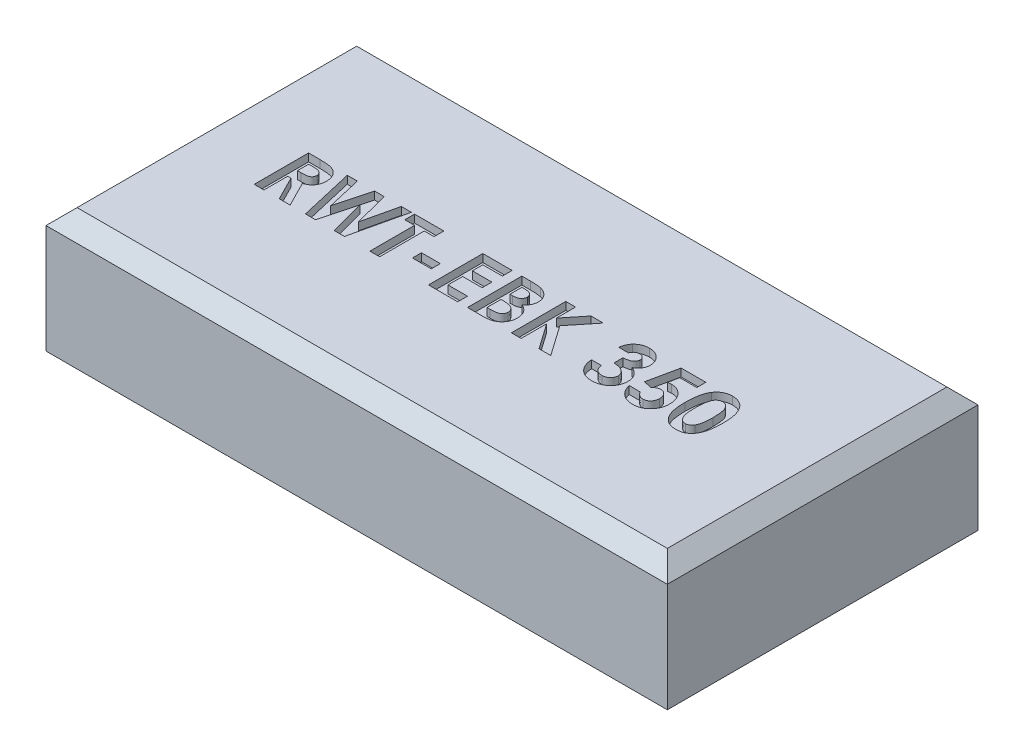
from build123d import *

# Parameters (mm, degrees)
SKETCH1_W           = 40
SKETCH1_H           = 20
BOSS_EXTRUDE1_DEPTH = 8
CHAMFER1_SIZE       = 1
SKETCH4_W           = 1.211538461
SKETCH4_H           = 0.583333333
CUT_EXTRUDE3_DEPTH  = 0.5


with BuildPart() as part:
    # Sketch1 → Boss-Extrude1 (new body)
    with BuildSketch(Plane(origin=(0, 0, 0), x_dir=(1, 0, 0), z_dir=(0, 1, 0))):
        with Locations((0, 2.318501171)):
            Rectangle(SKETCH1_W, SKETCH1_H)
    extrude(amount=BOSS_EXTRUDE1_DEPTH)

    # Chamfer1
    chamfer1_edges = [part.edges().sort_by_distance(p)[0] for p in [
        (0, 8, 7.681498829),
        (-20, 8, -2.318501171),
        (0, 8, -12.318501171),
        (20, 8, -2.318501171),
    ]]
    chamfer(chamfer1_edges, length=CHAMFER1_SIZE)

    # Sketch4 → Cut-Extrude3 (cut)
    # profile 1 of 10: a face of its own
    with BuildSketch(Plane(origin=(0, 8, 0), x_dir=(1, 0, 0), z_dir=(0, 1, 0))):
        with BuildLine():
            Line((-14.596153846, 3.818501171), (-13.864182692, 3.818501171))
            add(Edge.make_bspline(
                [(-13.864182692, 3.818501171), (-13.815799622, 3.818329439), (-13.722745349, 3.81799915), (-13.588566169, 3.81278806), (-13.46530414, 3.805536401), (-13.352776761, 3.794470177), (-13.251032173, 3.779797701), (-13.159968404, 3.76250128), (-13.079588115, 3.742788301), (-13.009213411, 3.718224373), (-12.945703721, 3.690516634), (-12.886503859, 3.658679935), (-12.830307791, 3.623068786), (-12.777491125, 3.582746162), (-12.727594872, 3.538437457), (-12.6805249, 3.49009807), (-12.636946351, 3.437318103), (-12.597129066, 3.380431058), (-12.560838815, 3.320587191), (-12.528765845, 3.257704336), (-12.502684052, 3.191738763), (-12.479637993, 3.123643816), (-12.463038663, 3.052446065), (-12.451494071, 2.978838632), (-12.443041573, 2.902562411), (-12.442555595, 2.850743733), (-12.442307692, 2.824310466)],
                knots=[0, 0, 0, 0, 1.749336639, 3.364467119, 4.854658419, 6.213483162, 7.451590619, 8.570285859, 9.5643256, 10.440900261, 11.26203566, 12.067320669, 12.869050712, 13.665104639, 14.467235401, 15.27997916, 16.102287765, 16.939272006, 17.78853747, 18.631303466, 19.488103222, 20.351255419, 21.228522269, 22.127379805, 23.044756219, 24, 24, 24, 24], degree=3))
            add(Edge.make_bspline(
                [(-12.442307692, 2.824310466), (-12.442951654, 2.796720207), (-12.444214347, 2.742620739), (-12.451015895, 2.663153032), (-12.46344699, 2.587123888), (-12.48227569, 2.514755912), (-12.503916836, 2.4451484), (-12.532694008, 2.379585653), (-12.565171892, 2.317114157), (-12.603744925, 2.258617595), (-12.646076944, 2.20279664), (-12.695308193, 2.151790002), (-12.748249241, 2.102856265), (-12.807876098, 2.059060474), (-12.871560358, 2.017441316), (-12.940567358, 1.979723274), (-13.014446736, 1.944958206), (-13.066387598, 1.925570802), (-13.092948718, 1.91565662)],
                knots=[0, 0, 0, 0, 1.099860209, 2.156625411, 3.176576793, 4.16617041, 5.135385252, 6.078461593, 7.016046972, 7.938469504, 8.868247731, 9.803980173, 10.76021508, 11.73834243, 12.748633912, 13.790971185, 14.870363756, 16, 16, 16, 16], degree=3))
            Line((-13.092948718, 1.91565662), (-12.28525641, 0.318501171))
            Line((-12.28525641, 0.318501171), (-12.983573718, 0.318501171))
            Line((-12.983573718, 0.318501171), (-13.754807692, 1.844142197))
            Line((-13.754807692, 1.844142197), (-13.967948718, 1.844142197))
            Line((-13.967948718, 1.844142197), (-13.967948718, 0.318501171))
            Line((-13.967948718, 0.318501171), (-14.596153846, 0.318501171))
            Line((-14.596153846, 0.318501171), (-14.596153846, 3.818501171))
        make_face()
        with BuildLine():
            Line((-13.967948718, 2.472347325), (-13.723257212, 2.472347325))
            add(Edge.make_bspline(
                [(-13.723257212, 2.472347325), (-13.693341641, 2.472684254), (-13.636059751, 2.473329401), (-13.55368087, 2.476321861), (-13.4788612, 2.483532211), (-13.41127944, 2.492642218), (-13.350595524, 2.503161037), (-13.297350732, 2.518235143), (-13.250724642, 2.534387429), (-13.211269776, 2.554460531), (-13.177560445, 2.577288002), (-13.148454596, 2.603220576), (-13.124379885, 2.633234229), (-13.104565169, 2.666513318), (-13.089151475, 2.70335219), (-13.07790066, 2.743346436), (-13.071613117, 2.786951643), (-13.070889714, 2.817045173), (-13.070512821, 2.832723927)],
                knots=[0, 0, 0, 0, 1.688639943, 3.233382647, 4.650958383, 5.928841754, 7.082724185, 8.122798841, 9.049171256, 9.863274652, 10.613301712, 11.341792392, 12.054588806, 12.776240173, 13.521029143, 14.301969904, 15.115324896, 16, 16, 16, 16], degree=3))
            add(Edge.make_bspline(
                [(-13.070512821, 2.832723927), (-13.071225372, 2.851273039), (-13.072625049, 2.88770933), (-13.086514186, 2.940164814), (-13.108622693, 2.988715953), (-13.1389274, 3.033143381), (-13.177092239, 3.072091531), (-13.220889403, 3.106424636), (-13.27126414, 3.133572687), (-13.317907356, 3.151479252), (-13.36034178, 3.162192934), (-13.398637509, 3.170176676), (-13.442984193, 3.175834983), (-13.493415313, 3.181836624), (-13.549802317, 3.185728385), (-13.612452548, 3.188568594), (-13.681186076, 3.189730664), (-13.729099873, 3.190102157), (-13.754106571, 3.190296043)],
                knots=[0, 0, 0, 0, 1.020303359, 2.004196876, 2.966617323, 3.9489082, 4.950758222, 5.960522915, 7.003732012, 8.091992268, 8.70421221, 9.413913587, 10.24622431, 11.166358409, 12.212345909, 13.359657661, 14.621978493, 16, 16, 16, 16], degree=3))
            Line((-13.754106571, 3.190296043), (-13.967948718, 3.190296043))
            Line((-13.967948718, 3.190296043), (-13.967948718, 2.472347325))
        make_face(mode=Mode.SUBTRACT)
    # profile 2 of 10: a face of its own
    with BuildSketch(Plane(origin=(0, 8, 0), x_dir=(1, 0, 0), z_dir=(0, 1, 0))):
        Polygon((-12.105769231, 3.818501171), (-11.457231571, 3.818501171), (-10.939102564, 1.584026011), (-10.345252404, 3.818501171), (-9.734575321, 3.818501171), (-9.144230769, 1.584026011), (-8.627504006, 3.818501171), (-7.977564103, 3.818501171), (-8.787359776, 0.318501171), (-9.443609776, 0.318501171), (-10.041666667, 2.581021203), (-10.643229167, 0.318501171), (-11.294571314, 0.318501171), align=None)
    # profile 3 of 10: a face of its own
    with BuildSketch(Plane(origin=(0, 8, 0), x_dir=(1, 0, 0), z_dir=(0, 1, 0))):
        Polygon((-7.775641026, 3.818501171), (-5.891025641, 3.818501171), (-5.891025641, 3.190296043), (-6.519230769, 3.190296043), (-6.519230769, 0.318501171), (-7.147435897, 0.318501171), (-7.147435897, 3.190296043), (-7.775641026, 3.190296043), align=None)
    # profile 4 of 10: a face of its own
    with BuildSketch(Plane(origin=(0, 8, 0), x_dir=(1, 0, 0), z_dir=(0, 1, 0))):
        with Locations((-4.791666667, 1.597347325)):
            Rectangle(SKETCH4_W, SKETCH4_H)
    # profile 5 of 10: a face of its own
    with BuildSketch(Plane(origin=(0, 8, 0), x_dir=(1, 0, 0), z_dir=(0, 1, 0))):
        Polygon((-3.378205128, 3.818501171), (-1.493589744, 3.818501171), (-1.493589744, 3.190296043), (-2.75, 3.190296043), (-2.75, 2.51721912), (-1.493589744, 2.51721912), (-1.493589744, 1.889013991), (-2.75, 1.889013991), (-2.75, 0.946706299), (-1.493589744, 0.946706299), (-1.493589744, 0.318501171), (-3.378205128, 0.318501171), align=None)
    # profile 6 of 10: a face of its own
    with BuildSketch(Plane(origin=(0, 8, 0), x_dir=(1, 0, 0), z_dir=(0, 1, 0))):
        with BuildLine():
            Line((-0.865384615, 0.318501171), (-0.865384615, 3.818501171))
            Line((-0.865384615, 3.818501171), (-0.304487179, 3.818501171))
            add(Edge.make_bspline(
                [(-0.304487179, 3.818501171), (-0.265220852, 3.818505652), (-0.189241252, 3.818514323), (-0.079622519, 3.814664873), (0.022039599, 3.809685178), (0.115421572, 3.804114058), (0.200682344, 3.794513904), (0.277692262, 3.784396391), (0.346605192, 3.772195293), (0.389210312, 3.76125053), (0.409254808, 3.756101331)],
                knots=[0, 0, 0, 0, 1.311965854, 2.538629056, 3.664479157, 4.713267157, 5.663616078, 6.530575999, 7.308677837, 8, 8, 8, 8], degree=3))
            add(Edge.make_bspline(
                [(0.409254808, 3.756101331), (0.435575266, 3.748838294), (0.487224455, 3.734585883), (0.561202576, 3.705802524), (0.631381143, 3.673807779), (0.697674471, 3.637307759), (0.759675491, 3.595861807), (0.817148578, 3.549140995), (0.871333285, 3.499020694), (0.920305637, 3.444104065), (0.964568575, 3.386074475), (1.003025131, 3.324947127), (1.03643895, 3.2616567), (1.063178757, 3.195406725), (1.083326699, 3.126502301), (1.09806282, 3.055237661), (1.107613822, 2.981387306), (1.108516267, 2.931144495), (1.108974359, 2.905640594)],
                knots=[0, 0, 0, 0, 1.099996261, 2.158545794, 3.195537121, 4.207578794, 5.205712374, 6.197378256, 7.190519799, 8.17788031, 9.159561366, 10.129234751, 11.085776129, 12.040971148, 13.00380137, 13.975669004, 14.972423361, 16, 16, 16, 16], degree=3))
            add(Edge.make_bspline(
                [(1.108974359, 2.905640594), (1.107776583, 2.872874775), (1.105418909, 2.808379286), (1.090357925, 2.713647082), (1.062116233, 2.624111532), (1.025162666, 2.538122532), (0.974917368, 2.456000819), (0.911115557, 2.377785442), (0.834790614, 2.30106803), (0.776245169, 2.255081117), (0.745793269, 2.231161427)],
                knots=[0, 0, 0, 0, 0.986156485, 1.941127874, 2.875419072, 3.804401753, 4.751181392, 5.761612777, 6.835722519, 8, 8, 8, 8], degree=3))
            add(Edge.make_bspline(
                [(0.745793269, 2.231161427), (0.770470028, 2.218564156), (0.818854324, 2.193864392), (0.887545811, 2.153265354), (0.951146629, 2.110083128), (1.009941945, 2.065186558), (1.062698461, 2.016672412), (1.111594582, 1.967336144), (1.154218027, 1.914350989), (1.192333195, 1.85960544), (1.225462281, 1.802306775), (1.254314061, 1.742551757), (1.278684124, 1.680136252), (1.299321324, 1.615377904), (1.314712554, 1.548053973), (1.324747963, 1.478140383), (1.332431699, 1.405875574), (1.333029422, 1.35665059), (1.333333333, 1.331622165)],
                knots=[0, 0, 0, 0, 1.164658916, 2.283573913, 3.35186032, 4.395461096, 5.390182219, 6.362969632, 7.312859996, 8.245001507, 9.165155236, 10.092416118, 11.032087915, 11.979892451, 12.947605196, 13.931445124, 14.948243989, 16, 16, 16, 16], degree=3))
            add(Edge.make_bspline(
                [(1.333333333, 1.331622165), (1.331361149, 1.283819302), (1.327469051, 1.189480545), (1.29901193, 1.050969584), (1.249676325, 0.91964863), (1.18342878, 0.796039608), (1.101799059, 0.683720797), (1.007948289, 0.585330494), (0.902821331, 0.502045287), (0.805829006, 0.445834233), (0.721938284, 0.40811136), (0.652453165, 0.384788701), (0.577827621, 0.363182624), (0.49669469, 0.348010391), (0.410525202, 0.334123096), (0.318478999, 0.325548791), (0.220728113, 0.319738197), (0.153588579, 0.318921849), (0.118990385, 0.318501171)],
                knots=[0, 0, 0, 0, 1.284142165, 2.534249414, 3.780121997, 5.041676246, 6.291546858, 7.49970053, 8.684500223, 9.883330709, 10.50184324, 11.153274765, 11.851151195, 12.587658647, 13.369265475, 14.195992086, 15.070362669, 16, 16, 16, 16], degree=3))
            Line((0.118990385, 0.318501171), (-0.865384615, 0.318501171))
        make_face()
        with BuildLine():
            Line((-0.237179487, 3.190296043), (-0.237179487, 2.42747553))
            Line((-0.237179487, 2.42747553), (-0.0703125, 2.42747553))
            add(Edge.make_bspline(
                [(-0.0703125, 2.42747553), (-0.047633777, 2.427673297), (-0.003853875, 2.428055074), (0.059381549, 2.432972233), (0.118180282, 2.441361212), (0.172319311, 2.453065948), (0.222302963, 2.467929257), (0.267811927, 2.485813017), (0.308646108, 2.507633149), (0.356085982, 2.540135198), (0.406233349, 2.587963419), (0.450377513, 2.657061193), (0.476378131, 2.736523371), (0.479273899, 2.792566252), (0.480769231, 2.821505979)],
                knots=[0, 0, 0, 0, 1.065314748, 2.056525647, 2.977365736, 3.853934255, 4.656397591, 5.425096493, 6.14721249, 6.826394842, 8.123232004, 9.372140726, 10.643011755, 12, 12, 12, 12], degree=3))
            add(Edge.make_bspline(
                [(0.480769231, 2.821505979), (0.479572691, 2.848612841), (0.47725923, 2.901022871), (0.451079951, 2.97461122), (0.410418355, 3.039825558), (0.362411626, 3.084459439), (0.317203962, 3.114943064), (0.278494386, 3.135015233), (0.236007719, 3.152983634), (0.188921466, 3.166722711), (0.137504514, 3.17703203), (0.082006625, 3.184602991), (0.022332045, 3.189756109), (-0.018885315, 3.190112204), (-0.040164263, 3.190296043)],
                knots=[0, 0, 0, 0, 1.347982417, 2.606269829, 3.849316587, 5.153353503, 5.842674298, 6.568177932, 7.326619318, 8.142485038, 9.012069166, 9.942760135, 10.937925643, 12, 12, 12, 12], degree=3))
            Line((-0.040164263, 3.190296043), (-0.237179487, 3.190296043))
        make_face(mode=Mode.SUBTRACT)
        with BuildLine():
            Line((-0.237179487, 1.844142197), (-0.237179487, 0.946706299))
            Line((-0.237179487, 0.946706299), (-0.056290064, 0.946706299))
            add(Edge.make_bspline(
                [(-0.056290064, 0.946706299), (-0.020527995, 0.946910607), (0.048229046, 0.947303413), (0.146723385, 0.952049449), (0.236279363, 0.960603342), (0.316659689, 0.971282188), (0.387987483, 0.985750355), (0.450021639, 1.004144774), (0.503612874, 1.02438184), (0.548439854, 1.049377018), (0.585060929, 1.078465208), (0.618107609, 1.108194036), (0.645051813, 1.142489048), (0.666370569, 1.179878054), (0.684821916, 1.219432285), (0.695950465, 1.262696318), (0.704423352, 1.308387911), (0.704889637, 1.339991798), (0.705128205, 1.356161427)],
                knots=[0, 0, 0, 0, 1.753078804, 3.370512758, 4.83203934, 6.162291463, 7.344201807, 8.395507345, 9.331626367, 10.147333109, 10.898971645, 11.62040215, 12.321813352, 13.025280112, 13.727906689, 14.453419512, 15.208716525, 16, 16, 16, 16], degree=3))
            add(Edge.make_bspline(
                [(0.705128205, 1.356161427), (0.704602095, 1.374651653), (0.703577374, 1.410665639), (0.695208464, 1.463303922), (0.67999942, 1.512445252), (0.660842888, 1.559346239), (0.634185556, 1.602327663), (0.602504228, 1.642876951), (0.564225095, 1.679620976), (0.521177978, 1.714782156), (0.470967777, 1.745567673), (0.413570936, 1.772279563), (0.348675643, 1.79458835), (0.27608088, 1.81235062), (0.196104895, 1.827425213), (0.108163951, 1.83642641), (0.012990452, 1.843120995), (-0.053004401, 1.843794061), (-0.087139423, 1.844142197)],
                knots=[0, 0, 0, 0, 0.845221588, 1.646264278, 2.427170338, 3.19324141, 3.95557735, 4.731569926, 5.540061037, 6.376114724, 7.268642756, 8.224665384, 9.265483498, 10.400594375, 11.639216012, 12.983232105, 14.439614077, 16, 16, 16, 16], degree=3))
            Line((-0.087139423, 1.844142197), (-0.237179487, 1.844142197))
        make_face(mode=Mode.SUBTRACT)
    # profile 7 of 10: a face of its own
    with BuildSketch(Plane(origin=(0, 8, 0), x_dir=(1, 0, 0), z_dir=(0, 1, 0))):
        Polygon((1.961538462, 3.818501171), (2.58974359, 3.818501171), (2.58974359, 2.586630177), (3.582532051, 3.818501171), (4.375500801, 3.818501171), (3.128205128, 2.270424248), (4.496794872, 0.318501171), (3.740284455, 0.318501171), (2.58974359, 1.959827293), (2.58974359, 0.318501171), (1.961538462, 0.318501171), align=None)
    # profile 8 of 10: a face of its own
    with BuildSketch(Plane(origin=(0, 8, 0), x_dir=(1, 0, 0), z_dir=(0, 1, 0))):
        with BuildLine():
            Line((6.852564103, 2.965937068), (6.224358974, 2.965937068))
            add(Edge.make_bspline(
                [(6.224358974, 2.965937068), (6.228794341, 2.997338802), (6.237489585, 3.05889982), (6.25829614, 3.148024838), (6.283183024, 3.232566017), (6.314253028, 3.312255633), (6.350693088, 3.387235639), (6.392132649, 3.45776333), (6.439019689, 3.523535987), (6.474959102, 3.563157697), (6.492888622, 3.582924248)],
                knots=[0, 0, 0, 0, 1.111473889, 2.178970933, 3.205615836, 4.199322666, 5.174200091, 6.12565194, 7.064921805, 8, 8, 8, 8], degree=3))
            add(Edge.make_bspline(
                [(6.492888622, 3.582924248), (6.518749579, 3.60900478), (6.569718807, 3.660406768), (6.654894365, 3.726247036), (6.74417408, 3.783227311), (6.839348495, 3.828401685), (6.938936626, 3.864965107), (7.04373043, 3.88952484), (7.153301684, 3.90582044), (7.22807028, 3.907425614), (7.266225962, 3.908244761)],
                knots=[0, 0, 0, 0, 1.01925491, 2.00884431, 2.983262333, 3.955970413, 4.92937149, 5.924503185, 6.940838805, 8, 8, 8, 8], degree=3))
            add(Edge.make_bspline(
                [(7.266225962, 3.908244761), (7.300148326, 3.90744392), (7.366832858, 3.905869629), (7.464842342, 3.893232074), (7.558286183, 3.87106721), (7.648152109, 3.842087147), (7.733118486, 3.802654929), (7.815060603, 3.756882516), (7.891688996, 3.70074075), (7.963182961, 3.637306204), (8.028863803, 3.568695533), (8.085743699, 3.495356368), (8.134644367, 3.419247767), (8.17493205, 3.339737412), (8.205907803, 3.256690761), (8.227405894, 3.170587565), (8.241476916, 3.081617815), (8.242878758, 3.021146275), (8.243589744, 2.990476331)],
                knots=[0, 0, 0, 0, 1.091422571, 2.145516843, 3.172569842, 4.178562979, 5.178154469, 6.181868002, 7.194278174, 8.227918432, 9.254613415, 10.245994977, 11.209837596, 12.161663635, 13.10878368, 14.055455738, 15.013766427, 16, 16, 16, 16], degree=3))
            add(Edge.make_bspline(
                [(8.243589744, 2.990476331), (8.242130758, 2.95249416), (8.239258465, 2.877718942), (8.21568922, 2.768279854), (8.178796942, 2.663636557), (8.125502458, 2.565253166), (8.058870779, 2.473397426), (7.97711594, 2.39114035), (7.882566532, 2.31719226), (7.811587032, 2.277452547), (7.775240385, 2.257102934)],
                knots=[0, 0, 0, 0, 0.992805628, 1.954529043, 2.915727527, 3.886831945, 4.871318353, 5.87440735, 6.911542536, 8, 8, 8, 8], degree=3))
            add(Edge.make_bspline(
                [(7.775240385, 2.257102934), (7.800188166, 2.248912052), (7.849209437, 2.232817336), (7.91888728, 2.201118976), (7.985142946, 2.166477923), (8.046835538, 2.126234151), (8.104578662, 2.082014939), (8.158020309, 2.033442287), (8.207479781, 1.980622105), (8.252149673, 1.923263901), (8.291795947, 1.86228501), (8.327368437, 1.799094007), (8.35664658, 1.732732589), (8.381448812, 1.663958648), (8.400331819, 1.592154081), (8.413627144, 1.517597124), (8.421312167, 1.440457846), (8.422484265, 1.388196032), (8.423076923, 1.361770402)],
                knots=[0, 0, 0, 0, 1.059543567, 2.081955587, 3.086750234, 4.076226789, 5.052108497, 6.020845489, 6.989030705, 7.970690546, 8.952259656, 9.923888338, 10.895517021, 11.877585046, 12.873342345, 13.889638361, 14.932918083, 16, 16, 16, 16], degree=3))
            add(Edge.make_bspline(
                [(8.423076923, 1.361770402), (8.421875525, 1.322935454), (8.419506612, 1.246360847), (8.404446172, 1.133574287), (8.376406347, 1.026042323), (8.339518404, 0.922527637), (8.290313891, 0.824366565), (8.232408452, 0.729306447), (8.161231032, 0.640643939), (8.082129552, 0.556035035), (7.994282747, 0.479112409), (7.899042519, 0.412423953), (7.798503119, 0.355193392), (7.692028462, 0.308731993), (7.579655542, 0.272951401), (7.461634826, 0.24708754), (7.337470424, 0.231263602), (7.252718505, 0.229604763), (7.209435096, 0.228757581)],
                knots=[0, 0, 0, 0, 1.005138573, 1.981928558, 2.936866704, 3.876260664, 4.820238198, 5.773547, 6.751179199, 7.756627054, 8.768222608, 9.766606018, 10.760583154, 11.757261445, 12.767156078, 13.807575856, 14.880313354, 16, 16, 16, 16], degree=3))
            add(Edge.make_bspline(
                [(7.209435096, 0.228757581), (7.168489689, 0.229650791), (7.088426364, 0.231397344), (6.971316994, 0.246514645), (6.860015623, 0.270900079), (6.754238208, 0.305273369), (6.654393993, 0.349849653), (6.559577553, 0.402930005), (6.471680928, 0.467575977), (6.389724778, 0.540869328), (6.315527135, 0.623100305), (6.249211916, 0.71236407), (6.192241383, 0.809000055), (6.144381897, 0.912595393), (6.106007614, 1.023331819), (6.075738092, 1.140984147), (6.054594335, 1.265782231), (6.048154959, 1.351645968), (6.044871795, 1.395424248)],
                knots=[0, 0, 0, 0, 1.066544725, 2.085487077, 3.070979577, 4.031932826, 4.977951092, 5.916076795, 6.857635327, 7.814973522, 8.776389752, 9.738577119, 10.707772778, 11.69409279, 12.707140348, 13.757286496, 14.856535458, 16, 16, 16, 16], degree=3))
            Line((6.044871795, 1.395424248), (6.673076923, 1.395424248))
            add(Edge.make_bspline(
                [(6.673076923, 1.395424248), (6.677057793, 1.373411954), (6.684811583, 1.33053724), (6.699934873, 1.268464184), (6.719642629, 1.21116692), (6.742429699, 1.158136191), (6.767043166, 1.108675722), (6.796782119, 1.064612209), (6.829467445, 1.024749149), (6.876632609, 0.977359505), (6.944058459, 0.928668623), (7.035105694, 0.88635393), (7.136387121, 0.861552321), (7.20719294, 0.858526601), (7.243790064, 0.856962709)],
                knots=[0, 0, 0, 0, 0.928156231, 1.807827665, 2.648129825, 3.438902246, 4.202261636, 4.936546065, 5.639352463, 6.338805438, 7.70633318, 9.064371875, 10.482673459, 12, 12, 12, 12], degree=3))
            add(Edge.make_bspline(
                [(7.243790064, 0.856962709), (7.263209792, 0.857295725), (7.301248694, 0.857948029), (7.357122177, 0.865177946), (7.410349537, 0.877085623), (7.461029913, 0.893267716), (7.509485937, 0.913552981), (7.554791811, 0.939709615), (7.597870981, 0.970120438), (7.638255136, 1.004310275), (7.675570928, 1.041564958), (7.706619862, 1.082818191), (7.73499634, 1.124738849), (7.755983788, 1.170069529), (7.774373314, 1.216370956), (7.785628643, 1.265323727), (7.794127225, 1.315900945), (7.794621129, 1.350513772), (7.794871795, 1.368080498)],
                knots=[0, 0, 0, 0, 1.110435564, 2.175094844, 3.216326037, 4.226890168, 5.215276772, 6.21526065, 7.213097102, 8.228249917, 9.239874822, 10.221364777, 11.178138315, 12.128914389, 13.072518965, 14.022636769, 14.996447288, 16, 16, 16, 16], degree=3))
            add(Edge.make_bspline(
                [(7.794871795, 1.368080498), (7.794206323, 1.387292705), (7.792881521, 1.425539807), (7.782057749, 1.481353411), (7.764964726, 1.535041599), (7.74122043, 1.586366615), (7.709512568, 1.635139286), (7.672097644, 1.682338139), (7.626027982, 1.725506557), (7.575483393, 1.76817723), (7.516871526, 1.805373188), (7.453046861, 1.839699592), (7.382331987, 1.867012812), (7.306453118, 1.891408576), (7.223974933, 1.909226863), (7.135409592, 1.922164677), (7.040899963, 1.931794874), (6.975753248, 1.933176484), (6.942307692, 1.933885786)],
                knots=[0, 0, 0, 0, 0.809814727, 1.612155564, 2.388397, 3.182215007, 3.988903953, 4.837162975, 5.715530372, 6.646997145, 7.623086902, 8.637258368, 9.698941581, 10.815059213, 11.996518529, 13.252603015, 14.589518788, 16, 16, 16, 16], degree=3))
            Line((6.942307692, 1.933885786), (6.942307692, 2.51721912))
            add(Edge.make_bspline(
                [(6.942307692, 2.51721912), (6.983949398, 2.520765461), (7.061852782, 2.527399962), (7.169986857, 2.542914974), (7.261021809, 2.563653343), (7.337145665, 2.588673062), (7.400354037, 2.6208049), (7.455572522, 2.656277029), (7.503129293, 2.697472724), (7.543321144, 2.743163534), (7.575473375, 2.792231179), (7.59822885, 2.843913002), (7.613255377, 2.896609906), (7.61467914, 2.932652999), (7.615384615, 2.950512389)],
                knots=[0, 0, 0, 0, 1.70044513, 3.18119609, 4.440695891, 5.496282586, 6.431922213, 7.318171381, 8.16090191, 8.983045123, 9.787564368, 10.536848927, 11.275007137, 12, 12, 12, 12], degree=3))
            add(Edge.make_bspline(
                [(7.615384615, 2.950512389), (7.614167468, 2.973299031), (7.611791854, 3.017773733), (7.593341546, 3.0814264), (7.561313904, 3.138167477), (7.518370458, 3.187877565), (7.466042377, 3.229399156), (7.404704693, 3.259543123), (7.335688437, 3.277254049), (7.287131782, 3.279090076), (7.262019231, 3.280039632)],
                knots=[0, 0, 0, 0, 1.009664648, 1.970651636, 2.907870547, 3.878035693, 4.867062054, 5.849714035, 6.887914197, 8, 8, 8, 8], degree=3))
            add(Edge.make_bspline(
                [(7.262019231, 3.280039632), (7.239257527, 3.278919255), (7.194091334, 3.276696084), (7.128044841, 3.26010292), (7.065322678, 3.232170393), (7.007223642, 3.193653085), (6.954586406, 3.147395431), (6.911386421, 3.092612841), (6.875454723, 3.032587436), (6.860224222, 2.988240953), (6.852564103, 2.965937068)],
                knots=[0, 0, 0, 0, 0.98818071, 1.960853194, 2.938124878, 3.957524365, 4.978590984, 5.968022688, 6.978025184, 8, 8, 8, 8], degree=3))
        make_face()
    # profile 9 of 10: a face of its own
    with BuildSketch(Plane(origin=(0, 8, 0), x_dir=(1, 0, 0), z_dir=(0, 1, 0))):
        with BuildLine():
            Line((9.387119391, 3.818501171), (10.980769231, 3.818501171))
            Line((10.980769231, 3.818501171), (10.980769231, 3.235167838))
            Line((10.980769231, 3.235167838), (9.884915865, 3.235167838))
            Line((9.884915865, 3.235167838), (9.748197115, 2.573308863))
            add(Edge.make_bspline(
                [(9.748197115, 2.573308863), (9.766827002, 2.578497522), (9.803568967, 2.588730623), (9.858920782, 2.598993128), (9.912564404, 2.605644958), (9.947765022, 2.606532224), (9.96484375, 2.606962709)],
                knots=[0, 0, 0, 0, 1.05461699, 2.079921384, 3.068411212, 4, 4, 4, 4], degree=3))
            add(Edge.make_bspline(
                [(9.96484375, 2.606962709), (10.002060088, 2.606109919), (10.075421688, 2.60442888), (10.1827404, 2.588470341), (10.285504407, 2.563336125), (10.383399238, 2.527489548), (10.476329265, 2.480834303), (10.564407137, 2.424394534), (10.647740954, 2.358071113), (10.724850358, 2.281822516), (10.795701698, 2.19809983), (10.857302898, 2.107544887), (10.909914167, 2.011448911), (10.951759351, 1.909214572), (10.984787138, 1.801483971), (11.008653754, 1.688188071), (11.022767277, 1.569192598), (11.024670399, 1.488010495), (11.025641026, 1.446606139)],
                knots=[0, 0, 0, 0, 1.01440847, 1.999622559, 2.951875003, 3.895578053, 4.836219714, 5.782137149, 6.743708247, 7.735272588, 8.734977101, 9.730283169, 10.717124674, 11.717316708, 12.737475749, 13.78628267, 14.87096371, 16, 16, 16, 16], degree=3))
            add(Edge.make_bspline(
                [(11.025641026, 1.446606139), (11.024454904, 1.404731748), (11.022114339, 1.322101333), (11.006844297, 1.200605395), (10.979892399, 1.084239715), (10.94287127, 0.972692784), (10.894098303, 0.866784445), (10.835442135, 0.765417568), (10.765911048, 0.669344566), (10.68618738, 0.579550304), (10.599517296, 0.497476624), (10.507234115, 0.425276252), (10.409986156, 0.364520223), (10.30777107, 0.31541908), (10.2011753, 0.276571129), (10.090166491, 0.248291676), (9.974205155, 0.232074981), (9.895482475, 0.229875532), (9.85546875, 0.228757581)],
                knots=[0, 0, 0, 0, 1.06808661, 2.107647099, 3.116961351, 4.110378221, 5.100014249, 6.085620622, 7.093190682, 8.119403071, 9.144090782, 10.133780668, 11.103064255, 12.062861538, 13.020824475, 13.992378307, 14.979551724, 16, 16, 16, 16], degree=3))
            add(Edge.make_bspline(
                [(9.85546875, 0.228757581), (9.819685666, 0.229672135), (9.749113937, 0.231475826), (9.645164879, 0.242562264), (9.544946443, 0.262163189), (9.44899068, 0.290530803), (9.356287975, 0.32544486), (9.267909998, 0.369111487), (9.183371097, 0.420699211), (9.102911331, 0.479266557), (9.027838055, 0.545240399), (8.959319124, 0.617460138), (8.896939715, 0.695015476), (8.84203465, 0.778863212), (8.79477604, 0.868879466), (8.75286614, 0.964003375), (8.718562467, 1.065228337), (8.701154341, 1.135403104), (8.692307692, 1.171065274)],
                knots=[0, 0, 0, 0, 1.054957082, 2.080596141, 3.077793124, 4.061112343, 5.027190972, 5.994718051, 6.962465889, 7.943658696, 8.924948258, 9.904494768, 10.875059, 11.855380583, 12.854004648, 13.869083016, 14.917087635, 16, 16, 16, 16], degree=3))
            Line((8.692307692, 1.171065274), (9.41025641, 1.171065274))
            add(Edge.make_bspline(
                [(9.41025641, 1.171065274), (9.42338053, 1.146352842), (9.448885759, 1.098327052), (9.497402344, 1.034565599), (9.551713581, 0.980192572), (9.611329552, 0.934676733), (9.676636533, 0.900577041), (9.744973386, 0.874717413), (9.8171986, 0.859774091), (9.86638716, 0.857906028), (9.891225962, 0.856962709)],
                knots=[0, 0, 0, 0, 1.104910296, 2.147267069, 3.153527244, 4.136738762, 5.099945312, 6.05603338, 7.018353, 8, 8, 8, 8], degree=3))
            add(Edge.make_bspline(
                [(9.891225962, 0.856962709), (9.908538273, 0.857614079), (9.942600538, 0.858895659), (9.9927859, 0.86567554), (10.040690032, 0.87851648), (10.086669091, 0.896298197), (10.130846587, 0.918474006), (10.172589223, 0.946469521), (10.212623243, 0.978693396), (10.250339168, 1.015670402), (10.284498925, 1.056891163), (10.314453296, 1.10118568), (10.341236634, 1.14756972), (10.361075462, 1.197880672), (10.377321784, 1.250616232), (10.389286233, 1.306174201), (10.396436341, 1.364619465), (10.397098249, 1.404518409), (10.397435897, 1.424871363)],
                knots=[0, 0, 0, 0, 0.978869489, 1.925942215, 2.855067702, 3.774946051, 4.70828698, 5.642468714, 6.60995405, 7.609372294, 8.622401667, 9.629904756, 10.629323, 11.642352373, 12.678539694, 13.745912462, 14.850161547, 16, 16, 16, 16], degree=3))
            add(Edge.make_bspline(
                [(10.397435897, 1.424871363), (10.397044018, 1.444751879), (10.396281215, 1.483449786), (10.389971156, 1.540272174), (10.378682582, 1.594186337), (10.363301804, 1.645605217), (10.343612571, 1.694216573), (10.319551013, 1.740309765), (10.291014335, 1.783651807), (10.257849331, 1.823360298), (10.222482512, 1.859782055), (10.184487184, 1.891636234), (10.144205664, 1.918072991), (10.102889652, 1.941153049), (10.05888996, 1.957950212), (10.013195966, 1.969517798), (9.965855722, 1.978005628), (9.933565969, 1.978504319), (9.917167468, 1.978757581)],
                knots=[0, 0, 0, 0, 1.166249705, 2.270133367, 3.348514167, 4.393962215, 5.415026464, 6.420877785, 7.440098956, 8.453121383, 9.451844239, 10.415694839, 11.355045125, 12.27538808, 13.187007209, 14.108269027, 15.039275622, 16, 16, 16, 16], degree=3))
            add(Edge.make_bspline(
                [(9.917167468, 1.978757581), (9.899354884, 1.978081693), (9.863654645, 1.976727067), (9.810613025, 1.965704839), (9.75821094, 1.94786674), (9.706156979, 1.923256255), (9.654967869, 1.891048895), (9.603292704, 1.853273355), (9.552861163, 1.807184883), (9.520795387, 1.772858084), (9.504206731, 1.755099729)],
                knots=[0, 0, 0, 0, 0.88288272, 1.769486374, 2.674910571, 3.623812639, 4.617874466, 5.670434592, 6.794841017, 8, 8, 8, 8], degree=3))
            Line((9.504206731, 1.755099729), (8.975560897, 1.876393799))
            Line((8.975560897, 1.876393799), (9.387119391, 3.818501171))
        make_face()
    # profile 10 of 10: a face of its own
    with BuildSketch(Plane(origin=(0, 8, 0), x_dir=(1, 0, 0), z_dir=(0, 1, 0))):
        with BuildLine():
            add(Edge.make_bspline(
                [(12.608072917, 3.908244761), (12.638480652, 3.907793349), (12.698270385, 3.906905754), (12.786329406, 3.897292372), (12.871154591, 3.882769234), (12.953077785, 3.86251452), (13.031509297, 3.835708128), (13.107019968, 3.803621336), (13.178711003, 3.764571127), (13.247496691, 3.720461909), (13.313350535, 3.670524021), (13.374689786, 3.613592251), (13.432634627, 3.550976601), (13.485930767, 3.481730434), (13.535758465, 3.406483618), (13.581953994, 3.325224221), (13.624163718, 3.237554532), (13.662860706, 3.143316345), (13.697463675, 3.04109707), (13.726609713, 2.929724208), (13.751607317, 2.809172324), (13.772707059, 2.679141347), (13.788655053, 2.539458435), (13.799404323, 2.390216385), (13.80678098, 2.231702915), (13.807383012, 2.122963977), (13.807692308, 2.067098927)],
                knots=[0, 0, 0, 0, 0.879237366, 1.728815576, 2.559023295, 3.367336655, 4.166867292, 4.954216142, 5.737608147, 6.525189134, 7.316157332, 8.124696809, 8.942788509, 9.781158001, 10.649253743, 11.551476218, 12.482711956, 13.461909668, 14.496590415, 15.601789533, 16.789733467, 18.056700938, 19.410929216, 20.8549011, 22.384193279, 24, 24, 24, 24], degree=3))
            add(Edge.make_bspline(
                [(13.807692308, 2.067098927), (13.807358042, 2.010534943), (13.806708571, 1.900632136), (13.799710973, 1.740668821), (13.787660778, 1.590343185), (13.772129618, 1.449670779), (13.750856176, 1.31872589), (13.725942019, 1.19716946), (13.69633592, 1.085045549), (13.660593141, 0.982606796), (13.622130387, 0.888203106), (13.579805201, 0.800704352), (13.534355307, 0.71987354), (13.486823186, 0.644491226), (13.434602955, 0.576779642), (13.380236318, 0.514436242), (13.321356056, 0.459835764), (13.260441254, 0.410164346), (13.195260358, 0.367238273), (13.12648556, 0.329695837), (13.052890726, 0.299244462), (12.975817364, 0.272759483), (12.893951743, 0.253746125), (12.808594697, 0.238659651), (12.718782561, 0.23032194), (12.657634842, 0.229287592), (12.626302083, 0.228757581)],
                knots=[0, 0, 0, 0, 1.643780988, 3.193836972, 4.651895693, 6.025988579, 7.305620092, 8.505800249, 9.631074763, 10.672816429, 11.65661981, 12.592235626, 13.49536222, 14.350718032, 15.179365177, 15.97804903, 16.751647189, 17.51006938, 18.259804725, 19.016521909, 19.783502495, 20.571750527, 21.382245291, 22.22305063, 23.089471752, 24, 24, 24, 24], degree=3))
            add(Edge.make_bspline(
                [(12.626302083, 0.228757581), (12.59497017, 0.229297816), (12.533591414, 0.230356128), (12.443536417, 0.238597657), (12.357727022, 0.253807241), (12.275213712, 0.272905453), (12.196570768, 0.299185861), (12.1214211, 0.330548319), (12.050342543, 0.367856509), (11.983138292, 0.410882596), (11.920037802, 0.460221675), (11.86006049, 0.515346009), (11.803339031, 0.576115872), (11.750736299, 0.643211936), (11.701390812, 0.71573861), (11.655817167, 0.794524112), (11.614042751, 0.879453732), (11.574760854, 0.970645855), (11.540629858, 1.070063741), (11.510254856, 1.17859518), (11.485372454, 1.297144871), (11.46536036, 1.425674728), (11.449382717, 1.563912456), (11.437497186, 1.711924777), (11.43046072, 1.869780633), (11.429818059, 1.978282826), (11.429487179, 2.034146203)],
                knots=[0, 0, 0, 0, 0.917216111, 1.796812873, 2.643793957, 3.46689424, 4.273913431, 5.068098542, 5.848489301, 6.620921603, 7.401012384, 8.190319798, 9.003608147, 9.831726257, 10.68377682, 11.569763213, 12.493818149, 13.453288342, 14.474581811, 15.568529029, 16.750744269, 18.018426408, 19.375425659, 20.823733699, 22.36466933, 24, 24, 24, 24], degree=3))
            add(Edge.make_bspline(
                [(11.429487179, 2.034146203), (11.430086537, 2.111763968), (11.431243006, 2.261528446), (11.445898626, 2.477894573), (11.46740936, 2.677887577), (11.499003532, 2.861172919), (11.538069289, 3.028429436), (11.588095025, 3.178555327), (11.645045686, 3.313627923), (11.693574966, 3.393645742), (11.716947115, 3.432183062)],
                knots=[0, 0, 0, 0, 1.288568992, 2.486310467, 3.599230591, 4.627010532, 5.572937695, 6.447898582, 7.252493626, 8, 8, 8, 8], degree=3))
            add(Edge.make_bspline(
                [(11.716947115, 3.432183062), (11.744123137, 3.470042113), (11.797257615, 3.544064019), (11.890164735, 3.641240945), (11.989981339, 3.72435141), (12.098757603, 3.791514551), (12.214773185, 3.844479409), (12.339024139, 3.881887892), (12.471051626, 3.903683818), (12.561717103, 3.906701743), (12.608072917, 3.908244761)],
                knots=[0, 0, 0, 0, 1.058512271, 2.069600068, 3.047294572, 4.004278952, 4.967380941, 5.939006123, 6.946246673, 8, 8, 8, 8], degree=3))
        make_face()
        with BuildLine():
            add(Edge.make_bspline(
                [(12.623497596, 3.280039632), (12.596008751, 3.278736716), (12.542116023, 3.276182308), (12.463915106, 3.254498986), (12.390176524, 3.221007927), (12.334085555, 3.180706674), (12.292102022, 3.142073089), (12.262767826, 3.107110952), (12.234479618, 3.068095726), (12.209494048, 3.023266856), (12.185901148, 2.974235095), (12.162843773, 2.920777869), (12.14394278, 2.861582152), (12.125373055, 2.797656056), (12.109104244, 2.727232193), (12.095474546, 2.649734927), (12.08329761, 2.564660285), (12.074804052, 2.471952543), (12.066885506, 2.371708697), (12.061209118, 2.263705442), (12.058835962, 2.147971914), (12.058081608, 2.068267952), (12.057692308, 2.027134985)],
                knots=[0, 0, 0, 0, 1.076674018, 2.110852608, 3.161083442, 4.239746716, 4.804137807, 5.395870207, 6.026861976, 6.692161227, 7.405688833, 8.16177676, 8.973626916, 9.841385931, 10.773283133, 11.807421078, 12.927755683, 14.143907515, 15.458935494, 16.872852025, 18.386167141, 20, 20, 20, 20], degree=3))
            add(Edge.make_bspline(
                [(12.057692308, 2.027134985), (12.05833305, 1.973845238), (12.05956172, 1.871658197), (12.065996919, 1.724709674), (12.078895741, 1.590974686), (12.094939272, 1.46954686), (12.117473067, 1.361213689), (12.143399656, 1.264950241), (12.175416688, 1.181983641), (12.212418538, 1.111114005), (12.253399754, 1.050825352), (12.297886667, 0.999579726), (12.344364656, 0.955203432), (12.394284452, 0.919157115), (12.44752696, 0.891532879), (12.503647703, 0.871663107), (12.562682345, 0.859499993), (12.603108659, 0.85781336), (12.623497596, 0.856962709)],
                knots=[0, 0, 0, 0, 1.771748488, 3.397459088, 4.888034009, 6.237357457, 7.467047327, 8.564189669, 9.548206622, 10.417051504, 11.216568818, 11.965764335, 12.669334354, 13.348544111, 14.005342236, 14.656555988, 15.322436492, 16, 16, 16, 16], degree=3))
            add(Edge.make_bspline(
                [(12.623497596, 0.856962709), (12.64318685, 0.857544788), (12.681735959, 0.858684424), (12.737949195, 0.87038264), (12.791108425, 0.889401398), (12.841053145, 0.916304766), (12.887962, 0.950516515), (12.931605729, 0.992186986), (12.971655179, 1.041731537), (12.994988171, 1.07850092), (13.007011218, 1.097447485)],
                knots=[0, 0, 0, 0, 0.992283464, 1.942767638, 2.88273346, 3.832339453, 4.79467288, 5.803907806, 6.868395428, 8, 8, 8, 8], degree=3))
            add(Edge.make_bspline(
                [(13.007011218, 1.097447485), (13.021166331, 1.12333736), (13.050848455, 1.177626329), (13.085196661, 1.269236938), (13.114109066, 1.372558565), (13.13899355, 1.487912756), (13.156013019, 1.615754481), (13.170670165, 1.755273086), (13.177739671, 1.907171129), (13.178889565, 2.012406641), (13.179487179, 2.067098927)],
                knots=[0, 0, 0, 0, 0.710965849, 1.490837728, 2.352621235, 3.297892224, 4.334225155, 5.461620853, 6.680770821, 8, 8, 8, 8], degree=3))
            add(Edge.make_bspline(
                [(13.179487179, 2.067098927), (13.179256334, 2.122265969), (13.178811995, 2.228453106), (13.170659668, 2.380897234), (13.15930693, 2.520129644), (13.142701151, 2.645839487), (13.121334799, 2.758331932), (13.095000689, 2.857599625), (13.063954732, 2.943838204), (13.027137927, 3.016961676), (12.986361029, 3.079106596), (12.943075106, 3.132422118), (12.897097128, 3.177941565), (12.848503986, 3.215836235), (12.796170975, 3.244790606), (12.741097722, 3.265234787), (12.683171324, 3.27760283), (12.64365732, 3.279216402), (12.623497596, 3.280039632)],
                knots=[0, 0, 0, 0, 1.793836731, 3.452829483, 4.963243077, 6.335886805, 7.574563692, 8.684454726, 9.672768357, 10.54971625, 11.340229787, 12.085688095, 12.778991901, 13.440269426, 14.083255152, 14.715733572, 15.344777694, 16, 16, 16, 16], degree=3))
        make_face(mode=Mode.SUBTRACT)
    extrude(amount=-CUT_EXTRUDE3_DEPTH, mode=Mode.SUBTRACT)


solid = part.part
